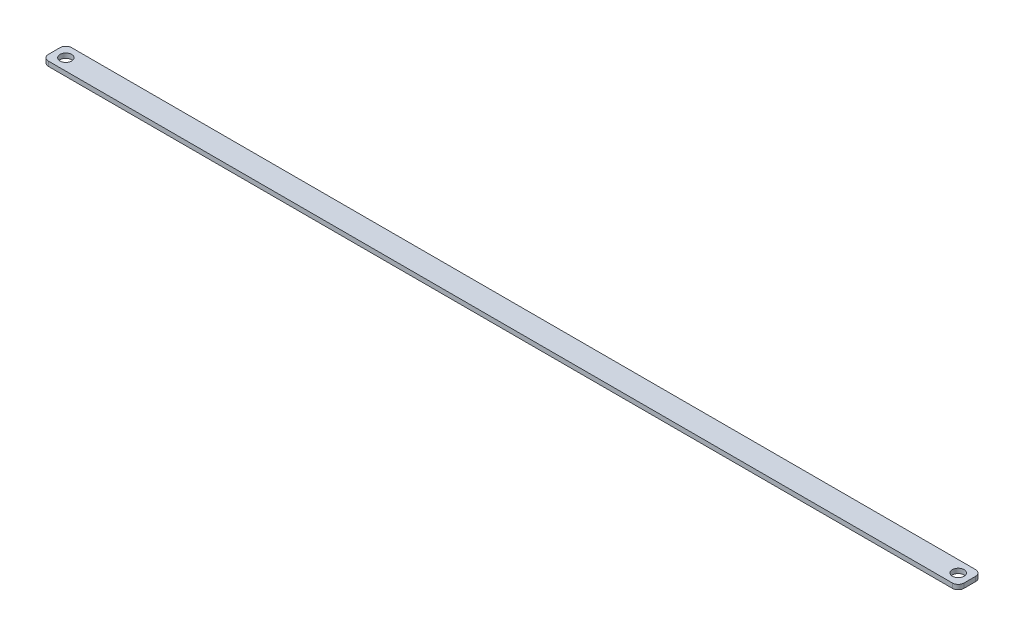
from build123d import *

# Parameters (mm, degrees)
SKETCH1_R           = 2.5
BOSS_EXTRUDE2_DEPTH = 2
FLEX1_OUTLINE_R     = 2.5
FLEX1_DEPTH         = 2


# Read off the part's stored shape, not the designer's step: Flex1
with BuildPart() as part:
    # Sketch1 → Boss-Extrude2 (new body)
    with BuildSketch(Plane(origin=(0, 0, 0), x_dir=(1, 0, 0), z_dir=(0, 1, 0))):
        with BuildLine():
            Line((2.5, 0), (47.5, 0))
            ThreePointArc((47.5, 0), (49.267766953, 0.732233047), (50, 2.5))
            Line((50, 2.5), (50, 7.5))
            ThreePointArc((50, 7.5), (49.267766953, 9.267766953), (47.5, 10))
            Line((47.5, 10), (2.5, 10))
            ThreePointArc((2.5, 10), (0.732233047, 9.267766953), (0, 7.5))
            Line((0, 7.5), (0, 2.5))
            ThreePointArc((0, 2.5), (0.732233047, 0.732233047), (2.5, 0))
        make_face()
        with Locations(Location((5, 5, 0), (0, 0, 270))):
            Circle(SKETCH1_R, mode=Mode.SUBTRACT)
        with Locations(Location((45, 5, 0), (0, 0, 270))):
            Circle(SKETCH1_R, mode=Mode.SUBTRACT)
    extrude(amount=BOSS_EXTRUDE2_DEPTH)

    # Flex1 outline → Flex1 (add)
    # profile 1 of 4: a face of its own
    with BuildSketch(Plane(origin=(0, 0, 0), x_dir=(1, 0, 0), z_dir=(0, 1, 0))):
        with BuildLine():
            Line((2.5, 10), (-165.346236693, 10))
            ThreePointArc((-165.346236693, 10), (-167.114003646, 9.267766953), (-167.846236693, 7.5))
            Line((-167.846236693, 7.5), (-167.846236693, 2.5))
            ThreePointArc((-167.846236693, 2.5), (-167.114003646, 0.732233047), (-165.346236693, 0))
            Line((-165.346236693, 0), (2.5, 0))
            ThreePointArc((2.5, 0), (0.732233047, 0.732233047), (0, 2.5))
            Line((0, 2.5), (0, 7.5))
            ThreePointArc((0, 7.5), (0.732233047, 9.267766953), (2.5, 10))
        make_face()
        with Locations((-162.846236693, 5)):
            Circle(FLEX1_OUTLINE_R, mode=Mode.SUBTRACT)
    # profile 2 of 4: a face of its own
    with BuildSketch(Plane(origin=(0, 0, 0), x_dir=(1, 0, 0), z_dir=(0, 1, 0))):
        with BuildLine():
            Line((223.653763307, 10), (47.5, 10))
            ThreePointArc((47.5, 10), (49.267766953, 9.267766953), (50, 7.5))
            Line((50, 7.5), (50, 2.5))
            ThreePointArc((50, 2.5), (49.267766953, 0.732233047), (47.5, 0))
            Line((47.5, 0), (223.653763307, 0))
            ThreePointArc((223.653763307, 0), (225.42153026, 0.732233047), (226.153763307, 2.5))
            Line((226.153763307, 2.5), (226.153763307, 7.5))
            ThreePointArc((226.153763307, 7.5), (225.42153026, 9.267766953), (223.653763307, 10))
        make_face()
        with Locations((221.153763307, 5)):
            Circle(FLEX1_OUTLINE_R, mode=Mode.SUBTRACT)
    # profile 3 of 4: a face of its own
    with BuildSketch(Plane(origin=(0, 0, 0), x_dir=(1, 0, 0), z_dir=(0, 1, 0))):
        with Locations((5, 5)):
            Circle(FLEX1_OUTLINE_R)
    # profile 4 of 4: a face of its own
    with BuildSketch(Plane(origin=(0, 0, 0), x_dir=(1, 0, 0), z_dir=(0, 1, 0))):
        with Locations((45, 5)):
            Circle(FLEX1_OUTLINE_R)
    extrude(amount=FLEX1_DEPTH)


solid = part.part
